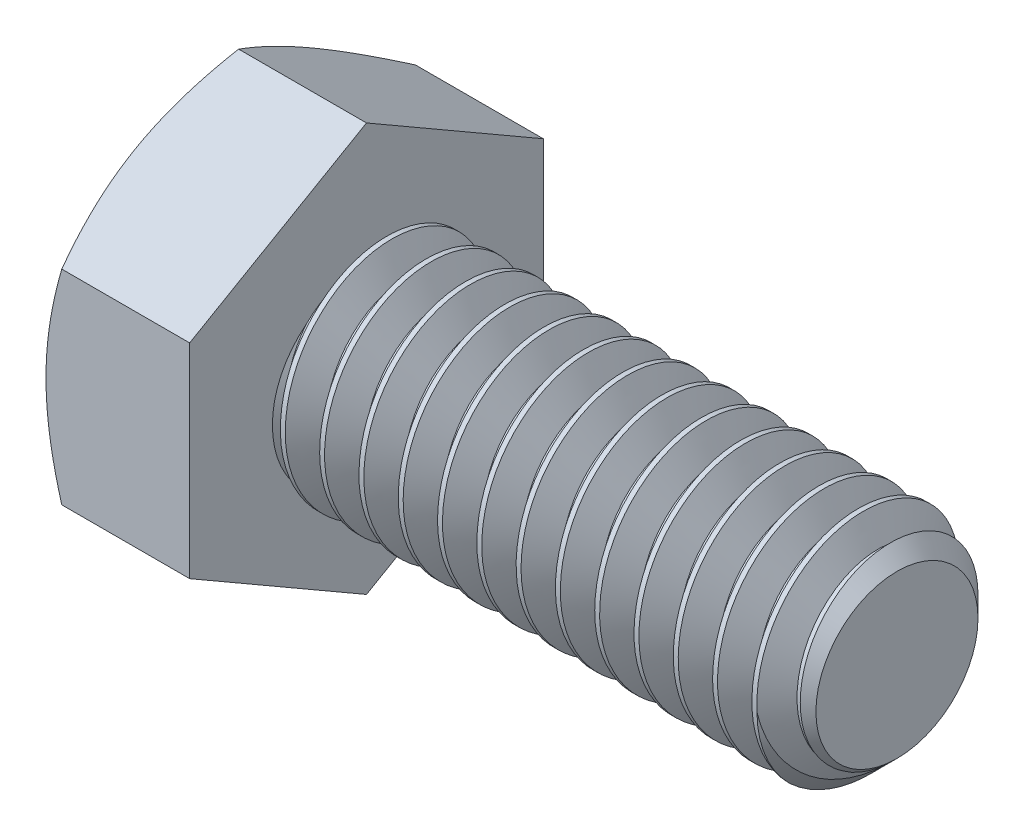
from build123d import *

# Parameters (mm, degrees)
SKETCH5_R           = 3.96875
BOSS_EXTRUDE3_DEPTH = 19.05
CHAMFER1_SIZE       = 1.058333333
CUT_SWEEP1_PITCH    = 1.411111111
BOSS_EXTRUDE4_DEPTH = 5.159375
SKETCH8_OUTSIDE_W   = 114.714
SKETCH8_OUTSIDE_H   = 116.678
SKETCH8_OUTSIDE_R   = 6.35
CUT_EXTRUDE3_DEPTH  = 27.080254577
CUT_EXTRUDE3_DRAFT  = -60


with BuildPart() as part:
    # Sketch5 → Boss-Extrude3 (new body)
    with BuildSketch(Plane(origin=(12.1046875, 0, 0), x_dir=(0, 0, -1), z_dir=(1, 0, 0))):
        Circle(SKETCH5_R)
    extrude(amount=-BOSS_EXTRUDE3_DEPTH)

    # Chamfer1
    chamfer1_edges = [part.edges().sort_by_distance(p)[0] for p in [
        (12.1046875, 0, 3.96875),
    ]]
    chamfer(chamfer1_edges, length=CHAMFER1_SIZE)

    # Cut-Sweep1: the profile of Sketch10 profile screwed along a right-hand helix of 14.5 turns, 8 arcs to a turn; built about Z, then put on its axis
    cut_sweep1_z = Axis((0, 0, 0), (0, 0, 1))
    cut_sweep1_corners = [(3.96905, 0, 0.000173205), (3.052206448, 0, -0.529166667), (3.052206448, 0, -0.705555556), (3.96905, 0, -1.234895427)]
    with BuildLine(mode=Mode.PRIVATE) as cut_sweep1_profile:
        Line(cut_sweep1_corners[0], cut_sweep1_corners[1])
        Line(cut_sweep1_corners[1], cut_sweep1_corners[2])
        Line(cut_sweep1_corners[2], cut_sweep1_corners[3])
        Line(cut_sweep1_corners[3], cut_sweep1_corners[0])
    cut_sweep1_cap = Face(cut_sweep1_profile.wire())
    cut_sweep1_turn_angles = [0, 22.5, 45, 67.5, 90, 112.5, 135, 157.5, 180, 202.5, 225, 247.5, 270, 292.5, 315, 337.5, 360]
    cut_sweep1_turn_weights = [1, 0.9238795325112867, 1, 0.9238795325112867, 1, 0.9238795325112867, 1, 0.9238795325112867, 1, 0.9238795325112867, 1, 0.9238795325112867, 1, 0.9238795325112867, 1, 0.9238795325112867, 1]
    cut_sweep1_turn_rails = [Edge.make_bspline([Vector(p[0], p[1], 0).rotate(cut_sweep1_z, cut_sweep1_turn_angles[k]) / cut_sweep1_turn_weights[k] + Vector(0, 0, p[2] + CUT_SWEEP1_PITCH * cut_sweep1_turn_angles[k] / 360) for k in range(17)], [0, 0, 0, 1, 1, 2, 2, 3, 3, 4, 4, 5, 5, 6, 6, 7, 7, 8, 8, 8], 2, cut_sweep1_turn_weights) for p in cut_sweep1_corners]
    cut_sweep1_turn_sides = [Face.make_surface_from_curves(cut_sweep1_turn_rails[p[0]], cut_sweep1_turn_rails[p[1]]) for p in [(0, 1), (1, 2), (2, 3), (3, 0)]]
    cut_sweep1_last_angles = [5040, 5062.5, 5085, 5107.5, 5130, 5152.5, 5175, 5197.5, 5220]
    cut_sweep1_last_weights = [1, 0.9238795325112867, 1, 0.9238795325112867, 1, 0.9238795325112867, 1, 0.9238795325113293, 1]
    cut_sweep1_last_rails = [Edge.make_bspline([Vector(p[0], p[1], 0).rotate(cut_sweep1_z, cut_sweep1_last_angles[k]) / cut_sweep1_last_weights[k] + Vector(0, 0, p[2] + CUT_SWEEP1_PITCH * cut_sweep1_last_angles[k] / 360) for k in range(9)], [0, 0, 0, 1, 1, 2, 2, 3, 3, 4, 4, 4], 2, cut_sweep1_last_weights) for p in cut_sweep1_corners]
    cut_sweep1_last_sides = [Face.make_surface_from_curves(cut_sweep1_last_rails[p[0]], cut_sweep1_last_rails[p[1]]) for p in [(0, 1), (1, 2), (2, 3), (3, 0)]]
    cut_sweep1 = Plane(origin=(12.1046875, 0, 0), x_dir=(0, 1, 0), z_dir=(-1, 0, 0)) * Solid(Shell([*[p.moved(Location((0, 0, CUT_SWEEP1_PITCH * i))) for i in range(14) for p in cut_sweep1_turn_sides], *cut_sweep1_last_sides, cut_sweep1_cap, cut_sweep1_cap.rotate(cut_sweep1_z, 5220).moved(Location((0, 0, CUT_SWEEP1_PITCH * 5220 / 360)))]))
    add(cut_sweep1, mode=Mode.SUBTRACT)

    # Sketch6 → Boss-Extrude4 (add)
    with BuildSketch(Plane.ZY.offset(6.9453125)):
        Polygon((6.35, 3.666174209), (0, 7.332348419), (-6.35, 3.666174209), (-6.35, -3.666174209), (0, -7.332348419), (6.35, -3.666174209), align=None)
    extrude(amount=BOSS_EXTRUDE4_DEPTH)


with BuildPart() as cut_extrude3_tool:
    # Sketch8 outside → Cut-Extrude3 (with draft: the straight prism first)
    with BuildSketch(Plane.ZY.offset(12.1046875)):
        Rectangle(SKETCH8_OUTSIDE_W, SKETCH8_OUTSIDE_H)
        Circle(SKETCH8_OUTSIDE_R, mode=Mode.SUBTRACT)
    extrude(amount=-CUT_EXTRUDE3_DEPTH)
    # Cut-Extrude3: the draft: its side faces are tilted about the plane it starts from
    cut_extrude3_sides = [cut_extrude3_tool.faces().sort_by_distance(p)[0] for p in [
        (1.435439789, -58.339, 0),
        (1.435439789, 0, 57.357),
        (1.435439789, 58.339, 0),
        (1.435439789, 0, -57.357),
        (1.435439789, 0, -6.35),
    ]]
    draft(cut_extrude3_sides, Plane.ZY.offset(12.1046875), CUT_EXTRUDE3_DRAFT)


with BuildPart() as part_1:
    add(part.part)

    # Cut-Extrude3: cut by cut_extrude3_tool
    add(cut_extrude3_tool.part, mode=Mode.SUBTRACT)


solid = part_1.part
